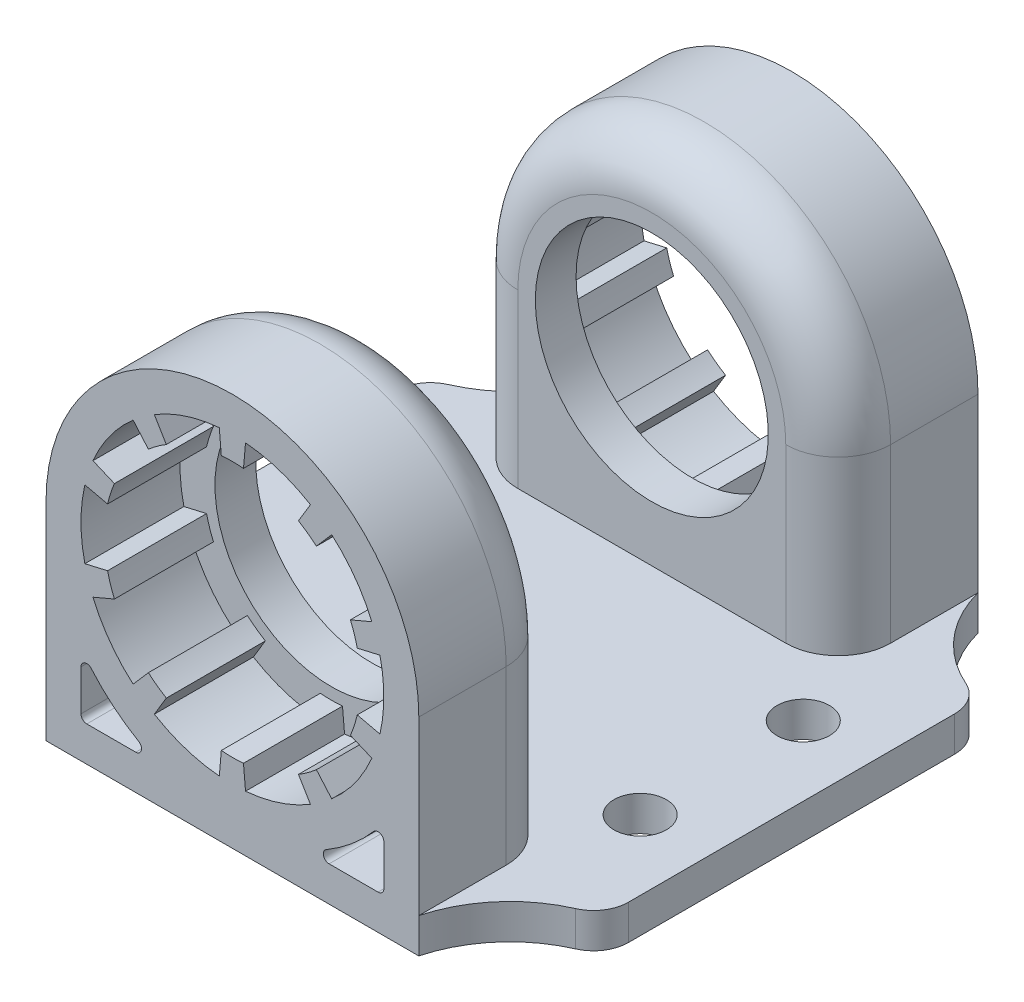
from build123d import *

# Parameters (mm, degrees)
SALIENTE_EXTRUIR1_DEPTH = 6
CROQUIS3_R              = 4
CORTAR_EXTRUIR1_DEPTH   = 49.038917556
CROQUIS4_R              = 13
CORTAR_EXTRUIR2_DEPTH   = 8.5
CROQUIS5_R              = 10
CORTAR_EXTRUIR3_DEPTH   = 8.5
CROQUIS6_W              = 32
CROQUIS6_H              = 3
SALIENTE_EXTRUIR2_DEPTH = 24
SALIENTE_EXTRUIR3_DEPTH = 3
REDONDEO1_R             = 11
CROQUIS8_R              = 2.25
CORTAR_EXTRUIR4_DEPTH   = 66.65194285
SALIENTE_EXTRUIR4_DEPTH = 8.5
MATRIZC1_COUNT          = 10
SIMETR_A3_COPY_1_DEPTH  = 8.5
SIMETR_A3_COPY_2_DEPTH  = 8.5
SIMETR_A3_COPY_3_DEPTH  = 8.5
SIMETR_A3_COPY_4_DEPTH  = 8.5
SIMETR_A3_COPY_5_DEPTH  = 8.5
SIMETR_A3_COPY_6_DEPTH  = 8.5
SIMETR_A3_COPY_7_DEPTH  = 8.5
SIMETR_A3_COPY_8_DEPTH  = 8.5
SIMETR_A3_COPY_9_DEPTH  = 8.5
REDONDEO2_R             = 4.5
CORTAR_EXTRUIR5_DEPTH   = 9
SIMETR_A5_COPY_1_DEPTH  = 9


with BuildPart() as part:
    # Croquis2 → Saliente-Extruir1 (new, symmetric)
    with BuildSketch(Plane.XY):
        with BuildLine():
            Line((0, 0), (-32, 0))
            Line((-32, 0), (-32, 17.76))
            ThreePointArc((-32, 17.76), (-16, 33.76), (0, 17.76))
            Line((0, 17.76), (0, 0))
        make_face()
    saliente_extruir1 = extrude(amount=SALIENTE_EXTRUIR1_DEPTH, both=True)

    # Croquis3 → Cortar-Extruir1 (cut, through all)
    with BuildSketch(Plane.XY.offset(6)):
        with Locations((-16, 17.76)):
            Circle(CROQUIS3_R)
    extrude(amount=-CORTAR_EXTRUIR1_DEPTH, mode=Mode.SUBTRACT)

    # Croquis4 → Cortar-Extruir2 (cut)
    with BuildSketch(Plane.XY.offset(6)):
        with Locations((-16, 17.76)):
            Circle(CROQUIS4_R)
    cortar_extruir2 = extrude(amount=-CORTAR_EXTRUIR2_DEPTH, mode=Mode.SUBTRACT)

    # Croquis5 → Cortar-Extruir3 (cut)
    with BuildSketch(Plane.XY.offset(-2.5)):
        with Locations((-16, 17.76)):
            Circle(CROQUIS5_R)
    cortar_extruir3 = extrude(amount=-CORTAR_EXTRUIR3_DEPTH, mode=Mode.SUBTRACT)

    # Croquis6 → Saliente-Extruir2 (add)
    with BuildSketch(Plane(origin=(0, 0, -6), x_dir=(-1, 0, 0), z_dir=(0, 0, -1))):
        with Locations((16, 1.5)):
            Rectangle(CROQUIS6_W, CROQUIS6_H)
    extrude(amount=SALIENTE_EXTRUIR2_DEPTH)

    # Simetría1: Saliente-Extruir1, Cortar-Extruir2, Cortar-Extruir3 across plane
    add(saliente_extruir1.mirror(Plane(origin=(0, 0, -18), x_dir=(1, 0, 0), z_dir=(0, 0, -1))))
    add(cortar_extruir2.mirror(Plane(origin=(0, 0, -18), x_dir=(1, 0, 0), z_dir=(0, 0, -1))), mode=Mode.SUBTRACT)
    add(cortar_extruir3.mirror(Plane(origin=(0, 0, -18), x_dir=(1, 0, 0), z_dir=(0, 0, -1))), mode=Mode.SUBTRACT)

    # Croquis7 → Saliente-Extruir3 (add)
    with BuildSketch(Plane(origin=(0, 0, 0), x_dir=(1, 0, 0), z_dir=(0, 1, 0))):
        with BuildLine():
            Line((0, 35), (5, 35))
            ThreePointArc((5, 35), (7.121320344, 34.121320344), (8, 32))
            Line((8, 32), (8, 4))
            ThreePointArc((8, 4), (7.121320344, 1.878679656), (5, 1))
            Line((5, 1), (0, 1))
            Line((0, 1), (0, 35))
        make_face()
        with BuildLine():
            Line((-32, 1), (-37, 1))
            ThreePointArc((-37, 1), (-39.121320344, 1.878679656), (-40, 4))
            Line((-40, 4), (-40, 32))
            ThreePointArc((-40, 32), (-39.121320344, 34.121320344), (-37, 35))
            Line((-37, 35), (-32, 35))
            Line((-32, 35), (-32, 1))
        make_face()
    extrude(amount=SALIENTE_EXTRUIR3_DEPTH)

    # Redondeo1
    # the kernel refuses this fillet: 11 mm, written as the material it adds along each edge
    with BuildSketch(Plane(origin=(0, 0, -35), x_dir=(0, 0, -1), z_dir=(0, 1, 0)), Plane(origin=(-32, 0, -1), x_dir=(0, 0, 1), z_dir=(0, 1, 0))) as redondeo1_piece_1:
        with BuildLine():
            CenterArc((9.816637832, -10.633275663), REDONDEO1_R, 104.836284751, 51.436865128)
            Line((-0.253577608, -6.207130499), (-1.260599151, -5.764515983))
            ThreePointArc((-1.260599151, -5.764515983), (-1.1, -5), (-1.1, 0))
            Line((-1.1, 0), (0, 1.1))
            ThreePointArc((0, 1.1), (3.5, 1.1), (6.718336217, 1.063327566))
            Line((6.718336217, 1.063327566), (7, 0))
        make_face()
    extrude(amount=3)
    with BuildSketch(Plane(origin=(0, 0, -1), x_dir=(0, 0, 1), z_dir=(0, 1, 0)), Plane(origin=(-32, 0, -35), x_dir=(0, 0, -1), z_dir=(0, 1, 0))) as redondeo1_piece_2:
        with BuildLine():
            CenterArc((9.816637832, 10.633275663), REDONDEO1_R, 203.726850121, 51.436865128)
            Line((-0.253577608, 6.207130499), (-1.260599151, 5.764515983))
            ThreePointArc((-1.260599151, 5.764515983), (-1.1, 5), (-1.1, 0))
            Line((-1.1, 0), (0, -1.1))
            ThreePointArc((0, -1.1), (3.5, -1.1), (6.718336217, -1.063327566))
            Line((6.718336217, -1.063327566), (7, 0))
        make_face()
    extrude(amount=3)

    # Croquis8 → Cortar-Extruir4 (cut, through all)
    with BuildSketch(Plane(origin=(0, 3, 0), x_dir=(1, 0, 0), z_dir=(0, 1, 0))):
        with Locations(Location((2, 25, 0), (0, 0, 180))):
            Circle(CROQUIS8_R)
        with Locations((2, 11)):
            Circle(CROQUIS8_R)
    cortar_extruir4 = extrude(amount=-CORTAR_EXTRUIR4_DEPTH, mode=Mode.SUBTRACT)

    # Simetría2: Cortar-Extruir4 across plane
    add(cortar_extruir4.mirror(Plane.ZY.offset(16)), mode=Mode.SUBTRACT)

    # Croquis11 → Saliente-Extruir4 (add)
    with BuildSketch(Plane.XY.offset(6)):
        with BuildLine():
            Line((-17.125, 30.711230637), (-16.951923077, 28.718733616))
            ThreePointArc((-16.951923077, 28.718733616), (-16, 28.76), (-15.048076923, 28.718733616))
            Line((-15.048076923, 28.718733616), (-14.875, 30.711230637))
            ThreePointArc((-14.875, 30.711230637), (-16, 30.76), (-17.125, 30.711230637))
        make_face()
    saliente_extruir4 = extrude(amount=-SALIENTE_EXTRUIR4_DEPTH)

    # MatrizC1: Saliente-Extruir4 ×10 about axis
    matrizc1_axis = Axis((-16, 17.76, 0), (0, 0, 1))
    for i in range(1, MATRIZC1_COUNT):
        add(saliente_extruir4.rotate(matrizc1_axis, i * 360 / MATRIZC1_COUNT))

    # Simetría3: Saliente-Extruir4 across plane
    add(saliente_extruir4.mirror(Plane(origin=(0, 0, -18), x_dir=(1, 0, 0), z_dir=(0, 0, -1))))

    # Simetría3 copy 1 sketch → Simetría3 copy 1 (add)
    with BuildSketch(Plane(origin=(7.383337991, 12.796422217, -42), x_dir=(0.8090169943749475, 0.5877852522924731, 0), z_dir=(0, 0, -1))):
        with BuildLine():
            Line((-17.125, -30.711230637), (-16.951923077, -28.718733616))
            ThreePointArc((-16.951923077, -28.718733616), (-16, -28.76), (-15.048076923, -28.718733616))
            Line((-15.048076923, -28.718733616), (-14.875, -30.711230637))
            ThreePointArc((-14.875, -30.711230637), (-16, -30.76), (-17.125, -30.711230637))
        make_face()
    extrude(amount=-SIMETR_A3_COPY_1_DEPTH)

    # Simetría3 copy 2 sketch → Simetría3 copy 2 (add)
    with BuildSketch(Plane(origin=(5.835035639, 27.488762441, -42), x_dir=(0.30901699437494745, 0.9510565162951535, 0), z_dir=(0, 0, -1))):
        with BuildLine():
            Line((-17.125, -30.711230637), (-16.951923077, -28.718733616))
            ThreePointArc((-16.951923077, -28.718733616), (-16, -28.76), (-15.048076923, -28.718733616))
            Line((-15.048076923, -28.718733616), (-14.875, -30.711230637))
            ThreePointArc((-14.875, -30.711230637), (-16, -30.76), (-17.125, -30.711230637))
        make_face()
    extrude(amount=-SIMETR_A3_COPY_2_DEPTH)

    # Simetría3 copy 3 sketch → Simetría3 copy 3 (add)
    with BuildSketch(Plane(origin=(-4.053508181, 38.465046081, -42), x_dir=(-0.30901699437494734, 0.9510565162951536, 0), z_dir=(0, 0, -1))):
        with BuildLine():
            Line((-17.125, -30.711230637), (-16.951923077, -28.718733616))
            ThreePointArc((-16.951923077, -28.718733616), (-16, -28.76), (-15.048076923, -28.718733616))
            Line((-15.048076923, -28.718733616), (-14.875, -30.711230637))
            ThreePointArc((-14.875, -30.711230637), (-16, -30.76), (-17.125, -30.711230637))
        make_face()
    extrude(amount=-SIMETR_A3_COPY_3_DEPTH)

    # Simetría3 copy 4 sketch → Simetría3 copy 4 (add)
    with BuildSketch(Plane(origin=(-18.505205829, 41.532705857, -42), x_dir=(-0.8090169943749473, 0.5877852522924732, 0), z_dir=(0, 0, -1))):
        with BuildLine():
            Line((-17.125, -30.711230637), (-16.951923077, -28.718733616))
            ThreePointArc((-16.951923077, -28.718733616), (-16, -28.76), (-15.048076923, -28.718733616))
            Line((-15.048076923, -28.718733616), (-14.875, -30.711230637))
            ThreePointArc((-14.875, -30.711230637), (-16, -30.76), (-17.125, -30.711230637))
        make_face()
    extrude(amount=-SIMETR_A3_COPY_4_DEPTH)

    # Simetría3 copy 5 sketch → Simetría3 copy 5 (add)
    with BuildSketch(Plane(origin=(-32, 35.52, -42), x_dir=(-1, 0, 0), z_dir=(0, 0, -1))):
        with BuildLine():
            Line((-17.125, -30.711230637), (-16.951923077, -28.718733616))
            ThreePointArc((-16.951923077, -28.718733616), (-16, -28.76), (-15.048076923, -28.718733616))
            Line((-15.048076923, -28.718733616), (-14.875, -30.711230637))
            ThreePointArc((-14.875, -30.711230637), (-16, -30.76), (-17.125, -30.711230637))
        make_face()
    extrude(amount=-SIMETR_A3_COPY_5_DEPTH)

    # Simetría3 copy 6 sketch → Simetría3 copy 6 (add)
    with BuildSketch(Plane(origin=(-39.383337991, 22.723577783, -42), x_dir=(-0.8090169943749476, -0.587785252292473, 0), z_dir=(0, 0, -1))):
        with BuildLine():
            Line((-17.125, -30.711230637), (-16.951923077, -28.718733616))
            ThreePointArc((-16.951923077, -28.718733616), (-16, -28.76), (-15.048076923, -28.718733616))
            Line((-15.048076923, -28.718733616), (-14.875, -30.711230637))
            ThreePointArc((-14.875, -30.711230637), (-16, -30.76), (-17.125, -30.711230637))
        make_face()
    extrude(amount=-SIMETR_A3_COPY_6_DEPTH)

    # Simetría3 copy 7 sketch → Simetría3 copy 7 (add)
    with BuildSketch(Plane(origin=(-37.835035639, 8.031237559, -42), x_dir=(-0.30901699437494756, -0.9510565162951535, 0), z_dir=(0, 0, -1))):
        with BuildLine():
            Line((-17.125, -30.711230637), (-16.951923077, -28.718733616))
            ThreePointArc((-16.951923077, -28.718733616), (-16, -28.76), (-15.048076923, -28.718733616))
            Line((-15.048076923, -28.718733616), (-14.875, -30.711230637))
            ThreePointArc((-14.875, -30.711230637), (-16, -30.76), (-17.125, -30.711230637))
        make_face()
    extrude(amount=-SIMETR_A3_COPY_7_DEPTH)

    # Simetría3 copy 8 sketch → Simetría3 copy 8 (add)
    with BuildSketch(Plane(origin=(-27.946491819, -2.945046081, -42), x_dir=(0.30901699437494723, -0.9510565162951536, 0), z_dir=(0, 0, -1))):
        with BuildLine():
            Line((-17.125, -30.711230637), (-16.951923077, -28.718733616))
            ThreePointArc((-16.951923077, -28.718733616), (-16, -28.76), (-15.048076923, -28.718733616))
            Line((-15.048076923, -28.718733616), (-14.875, -30.711230637))
            ThreePointArc((-14.875, -30.711230637), (-16, -30.76), (-17.125, -30.711230637))
        make_face()
    extrude(amount=-SIMETR_A3_COPY_8_DEPTH)

    # Simetría3 copy 9 sketch → Simetría3 copy 9 (add)
    with BuildSketch(Plane(origin=(-13.494794171, -6.012705857, -42), x_dir=(0.8090169943749473, -0.5877852522924734, 0), z_dir=(0, 0, -1))):
        with BuildLine():
            Line((-17.125, -30.711230637), (-16.951923077, -28.718733616))
            ThreePointArc((-16.951923077, -28.718733616), (-16, -28.76), (-15.048076923, -28.718733616))
            Line((-15.048076923, -28.718733616), (-14.875, -30.711230637))
            ThreePointArc((-14.875, -30.711230637), (-16, -30.76), (-17.125, -30.711230637))
        make_face()
    extrude(amount=-SIMETR_A3_COPY_9_DEPTH)

    # Redondeo2
    redondeo2_edges = [part.edges().sort_by_distance(p)[0] for p in [
        (0, 10.38, -6),
        (-32, 10.38, -30),
        (0, 10.38, -30),
        (-16, 33.76, -30),
        (-32, 10.38, -6),
        (-16, 33.76, -6),
    ]]
    fillet(redondeo2_edges, radius=REDONDEO2_R)

    # Croquis12 → Cortar-Extruir5 (cut)
    with BuildSketch(Plane.XY.offset(6)):
        with BuildLine():
            Line((-3, 3.5), (-3, 6.989670386))
            ThreePointArc((-3, 6.989670386), (-3.325922344, 7.458388819), (-3.878787879, 7.31604401))
            ThreePointArc((-3.878787879, 7.31604401), (-5.773846905, 5.454481202), (-7.950790832, 3.932121212))
            ThreePointArc((-7.950790832, 3.932121212), (-8.181985169, 3.369732211), (-7.699253046, 3))
            Line((-7.699253046, 3), (-3.5, 3))
            ThreePointArc((-3.5, 3), (-3.146446609, 3.146446609), (-3, 3.5))
        make_face()
    cortar_extruir5 = extrude(amount=-CORTAR_EXTRUIR5_DEPTH, mode=Mode.SUBTRACT)

    # Simetría4: Cortar-Extruir5 across plane
    add(cortar_extruir5.mirror(Plane.ZY.offset(16)), mode=Mode.SUBTRACT)

    # Simetría5: Cortar-Extruir5 across plane
    add(cortar_extruir5.mirror(Plane(origin=(0, 0, -18), x_dir=(1, 0, 0), z_dir=(0, 0, -1))), mode=Mode.SUBTRACT)

    # Simetría5 copy 1 sketch → Simetría5 copy 1 (cut)
    with BuildSketch(Plane(origin=(-32, 0, -42), x_dir=(-1, 0, 0), z_dir=(0, 0, -1))):
        with BuildLine():
            Line((-3, 3.5), (-3, 6.989670386))
            ThreePointArc((-3, 6.989670386), (-3.325922344, 7.458388819), (-3.878787879, 7.31604401))
            ThreePointArc((-3.878787879, 7.31604401), (-5.773846905, 5.454481202), (-7.950790832, 3.932121212))
            ThreePointArc((-7.950790832, 3.932121212), (-8.181985169, 3.369732211), (-7.699253046, 3))
            Line((-7.699253046, 3), (-3.5, 3))
            ThreePointArc((-3.5, 3), (-3.146446609, 3.146446609), (-3, 3.5))
        make_face()
    extrude(amount=-SIMETR_A5_COPY_1_DEPTH, mode=Mode.SUBTRACT)


solid = part.part
